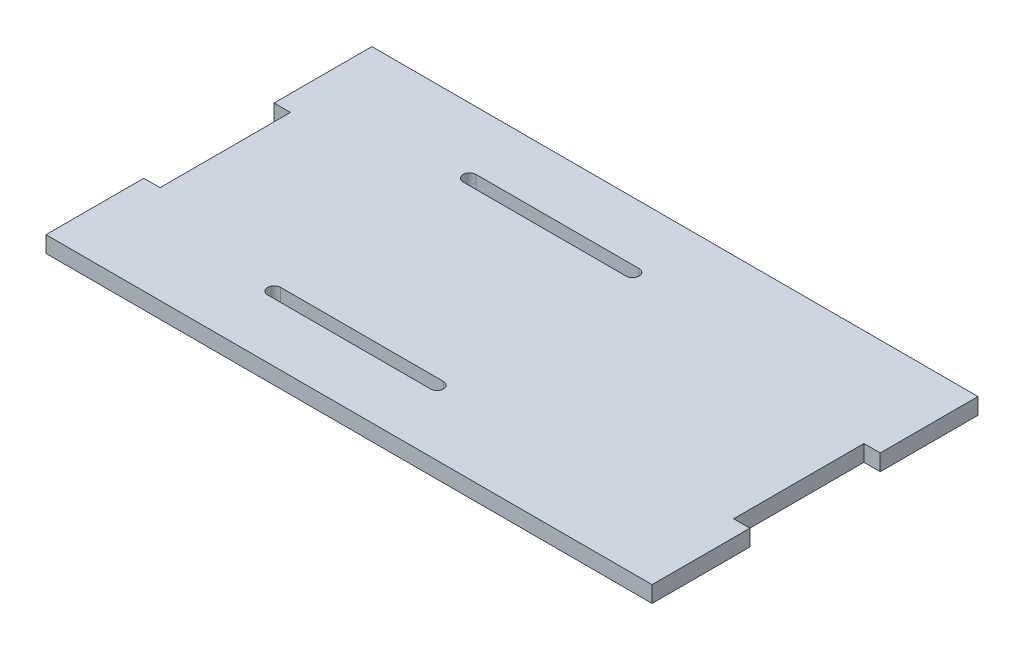
from build123d import *

# Parameters (mm, degrees)
SKIZZE1_W                       = 186
SKIZZE1_H                       = 100
AUFSATZ_LINEAR_AUSTRAGEN1_DEPTH = 5
SKIZZE2_W                       = 5
SKIZZE2_H                       = 40
SCHNITT_LINEAR_AUSTRAGEN1_DEPTH = 212.236833909
SCHNITT_LINEAR_AUSTRAGEN3_DEPTH = 212.236833909


with BuildPart() as part:
    # Skizze1 → Aufsatz-Linear austragen1 (new body)
    with BuildSketch(Plane(origin=(0, 0, 0), x_dir=(1, 0, 0), z_dir=(0, 1, 0))):
        with Locations((93, 50)):
            Rectangle(SKIZZE1_W, SKIZZE1_H)
    extrude(amount=AUFSATZ_LINEAR_AUSTRAGEN1_DEPTH)

    # Skizze2 → Schnitt-Linear austragen1 (cut, through all)
    with BuildSketch(Plane(origin=(0, 5, 0), x_dir=(1, 0, 0), z_dir=(0, 1, 0))):
        with Locations((183.5, 50)):
            Rectangle(SKIZZE2_W, SKIZZE2_H)
        with Locations((2.5, 50)):
            Rectangle(SKIZZE2_W, SKIZZE2_H)
    extrude(amount=-SCHNITT_LINEAR_AUSTRAGEN1_DEPTH, mode=Mode.SUBTRACT)

    # Skizze4 → Schnitt-Linear austragen3 (cut, through all)
    with BuildSketch(Plane(origin=(0, 5, 0), x_dir=(1, 0, 0), z_dir=(0, 1, 0))):
        with BuildLine():
            Line((100, 78), (50, 78))
            ThreePointArc((50, 78), (48, 80), (50, 82))
            Line((50, 82), (100, 82))
            ThreePointArc((100, 82), (102, 80), (100, 78))
        make_face()
        with BuildLine():
            Line((100, 22), (50, 22))
            ThreePointArc((50, 22), (48, 20), (50, 18))
            Line((50, 18), (100, 18))
            ThreePointArc((100, 18), (102, 20), (100, 22))
        make_face()
    extrude(amount=-SCHNITT_LINEAR_AUSTRAGEN3_DEPTH, mode=Mode.SUBTRACT)


solid = part.part
